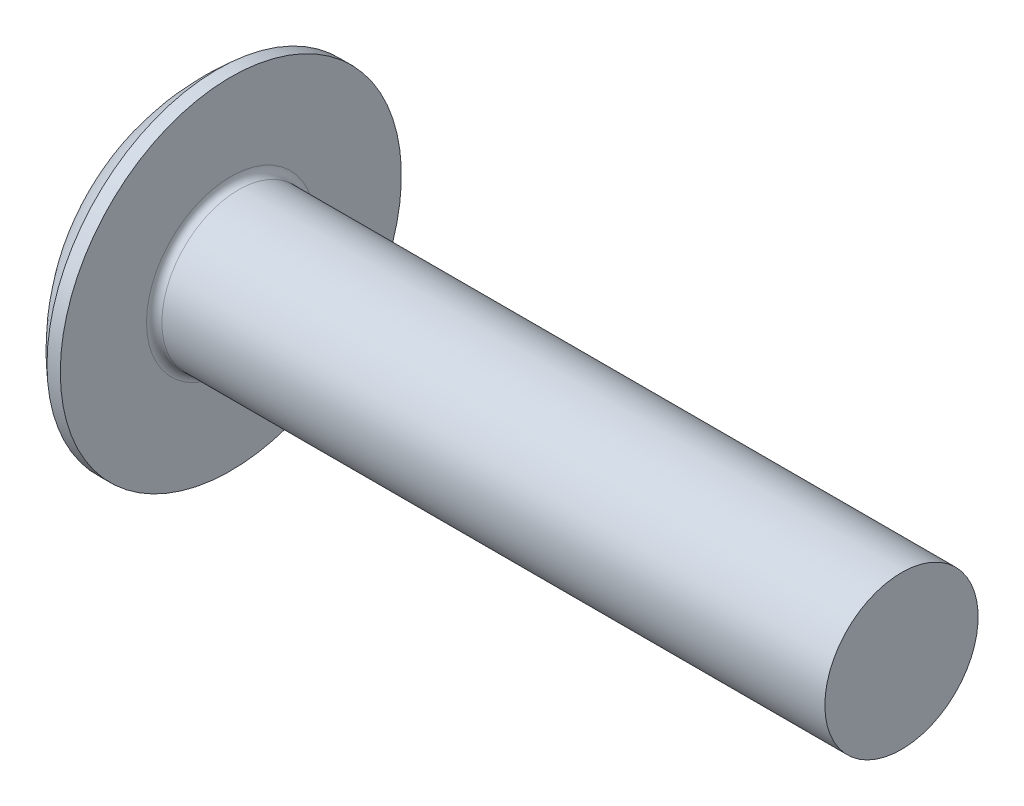
from build123d import *

# Parameters (mm, degrees)
FILLET1_R  = 0.4
SKETCH2_W  = 17.8
SKETCH2_H  = 1.6
SLOT_DEPTH = 2.4


with BuildPart() as part:
    # BodySke → Base-Revolve (revolve)
    with BuildSketch(Plane.XY):
        with BuildLine():
            Line((4.8, 4), (4.8, 8.9))
            Line((4.8, 8.9), (4.105264982, 8.9))
            ThreePointArc((4.105264982, 8.9), (1.075772976, 4.900591816), (0, 0))
            Line((0, 0), (39.8, 0))
            Line((39.8, 0), (39.8, 4))
            Line((39.8, 4), (4.8, 4))
        make_face()
    revolve(axis=Axis((-25.4, 0, 0), (1, 0, 0)))

    # Fillet1
    fillet1_edges = [part.edges().sort_by_distance(p)[0] for p in [
        (4.8, -4, 0),
    ]]
    fillet(fillet1_edges, radius=FILLET1_R)

    # Sketch2 → Slot (cut)
    with BuildSketch(Plane(origin=(0, 0, 0), x_dir=(0, 0, -1), z_dir=(1, 0, 0))):
        Rectangle(SKETCH2_W, SKETCH2_H)
    extrude(amount=SLOT_DEPTH, mode=Mode.SUBTRACT)


solid = part.part
